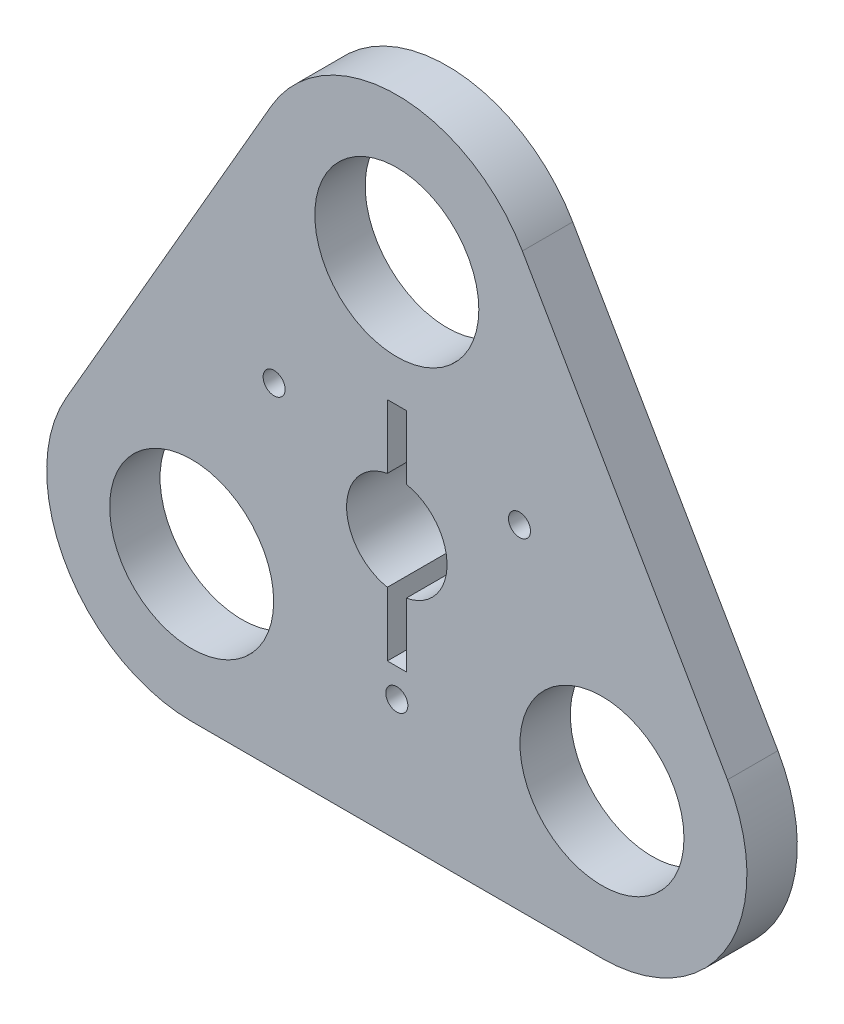
from build123d import *
from build123d.topology import SkipClean

# Parameters (mm, degrees)
SKETCH1_R           = 23.025
SKETCH1_R_2         = 13.025
SKETCH1_R_3         = 7.975
BOSS_EXTRUDE1_DEPTH = 4
BOSS_EXTRUDE3_START = 4
SKETCH5_R           = 7.975
BOSS_EXTRUDE3_DEPTH = 4
CHAMFER2_SIZE       = 4
CUT_EXTRUDE1_DEPTH  = 84.155314152
SKETCH3_R           = 1.75
CUT_EXTRUDE2_DEPTH  = 84.155314152
CIRPATTERN2_COUNT   = 3
CIRPATTERN3_COUNT   = 2


with BuildPart() as part:
    # Sketch1 → Boss-Extrude1 (new, symmetric)
    # profile 1 of 4: a face of its own
    with BuildSketch(Plane.XY):
        with Locations((0, 37.625)):
            Circle(SKETCH1_R)
        with Locations((0, 37.625)):
            Circle(SKETCH1_R_2, mode=Mode.SUBTRACT)
    # profile 2 of 4: a face of its own
    with BuildSketch(Plane.XY):
        with BuildLine():
            ThreePointArc((23.025, 37.625), (-5.959308513, 15.38455785), (-19.940234922, 49.1375))
            Line((-19.940234922, 49.1375), (-52.52444074, -7.3))
            ThreePointArc((-52.52444074, -7.3), (-26.624897304, 3.42794215), (-9.559205817, -18.8125))
            ThreePointArc((-9.559205817, -18.8125), (-16.303072181, -35.093633637), (-32.584205817, -41.8375))
            Line((-32.584205817, -41.8375), (32.584205817, -41.8375))
            ThreePointArc((32.584205817, -41.8375), (12.643970895, -7.3), (52.52444074, -7.3))
            Line((52.52444074, -7.3), (19.940234922, 49.1375))
            ThreePointArc((19.940234922, 49.1375), (22.24044215, 43.584308513), (23.025, 37.625))
        make_face()
        Circle(SKETCH1_R_3, mode=Mode.SUBTRACT)
    # profile 3 of 4: a face of its own
    with BuildSketch(Plane.XY):
        with Locations((-32.584205817, -18.8125)):
            Circle(SKETCH1_R)
        with Locations((-32.584205817, -18.8125)):
            Circle(SKETCH1_R_2, mode=Mode.SUBTRACT)
    # profile 4 of 4: a face of its own
    with BuildSketch(Plane.XY):
        with Locations((32.584205817, -18.8125)):
            Circle(SKETCH1_R)
        with Locations((32.584205817, -18.8125)):
            Circle(SKETCH1_R_2, mode=Mode.SUBTRACT)
    extrude(amount=BOSS_EXTRUDE1_DEPTH, both=True)

    # Sketch5 → Boss-Extrude3 (add)
    with SkipClean():  # the faces are left unmerged after this step: merging them gives an invalid solid
        with BuildSketch(Plane(origin=(0, 0, -4), x_dir=(-1, 0, 0), z_dir=(0, 0, -1)).offset(BOSS_EXTRUDE3_START)):
            with BuildLine():
                Line((-5.845671476, -25.875), (-25.331243061, 7.875))
                ThreePointArc((-25.331243061, 7.875), (-25.331243061, 14.625), (-19.485571585, 18))
                Line((-19.485571585, 18), (19.485571585, 18))
                ThreePointArc((19.485571585, 18), (25.331243061, 14.625), (25.331243061, 7.875))
                Line((25.331243061, 7.875), (5.845671476, -25.875))
                ThreePointArc((5.845671476, -25.875), (0, -29.25), (-5.845671476, -25.875))
            make_face()
            Circle(SKETCH5_R, mode=Mode.SUBTRACT)
        extrude(amount=-BOSS_EXTRUDE3_DEPTH)

    # Chamfer2
    chamfer2_edges = [part.edges().sort_by_distance(p)[0] for p in [
        (0, -29.25, -4),
        (-15.588457268, -9, -4),
        (15.588457268, -9, -4),
        (-25.331243061, 14.625, -4),
        (25.331243061, 14.625, -4),
        (0, 18, -4),
    ]]
    chamfer(chamfer2_edges, length=CHAMFER2_SIZE - 0.0001)  # a hair under: the kernel refuses the full size

    # Sketch2 → Cut-Extrude1 (cut, through all)
    with BuildSketch(Plane.XY.offset(4)):
        with BuildLine():
            Line((-1.5, 17.975), (-1.5, 7.832663978))
            ThreePointArc((-1.5, 7.832663978), (0, 7.975), (1.5, 7.832663978))
            Line((1.5, 7.832663978), (1.5, 17.975))
            Line((1.5, 17.975), (-1.5, 17.975))
        make_face()
    cut_extrude1 = extrude(amount=-CUT_EXTRUDE1_DEPTH, mode=Mode.SUBTRACT)

    # Sketch3 → Cut-Extrude2 (cut, through all)
    with BuildSketch(Plane.XY.offset(4)):
        with Locations((-19.485571585, 11.25)):
            Circle(SKETCH3_R)
    cut_extrude2 = extrude(amount=-CUT_EXTRUDE2_DEPTH, mode=Mode.SUBTRACT)

    # CirPattern2: Cut-Extrude2 ×3 about axis
    cirpattern2_axis = Axis((0, 0, 0), (0, 0, 1))
    for i in range(1, CIRPATTERN2_COUNT):
        add(cut_extrude2.rotate(cirpattern2_axis, i * 360 / CIRPATTERN2_COUNT), mode=Mode.SUBTRACT)

    # CirPattern3: Cut-Extrude1 ×2 about axis
    cirpattern3_axis = Axis((0, 0, 0), (0, 0, 1))
    for i in range(1, CIRPATTERN3_COUNT):
        add(cut_extrude1.rotate(cirpattern3_axis, i * 360 / CIRPATTERN3_COUNT), mode=Mode.SUBTRACT)


solid = part.part
